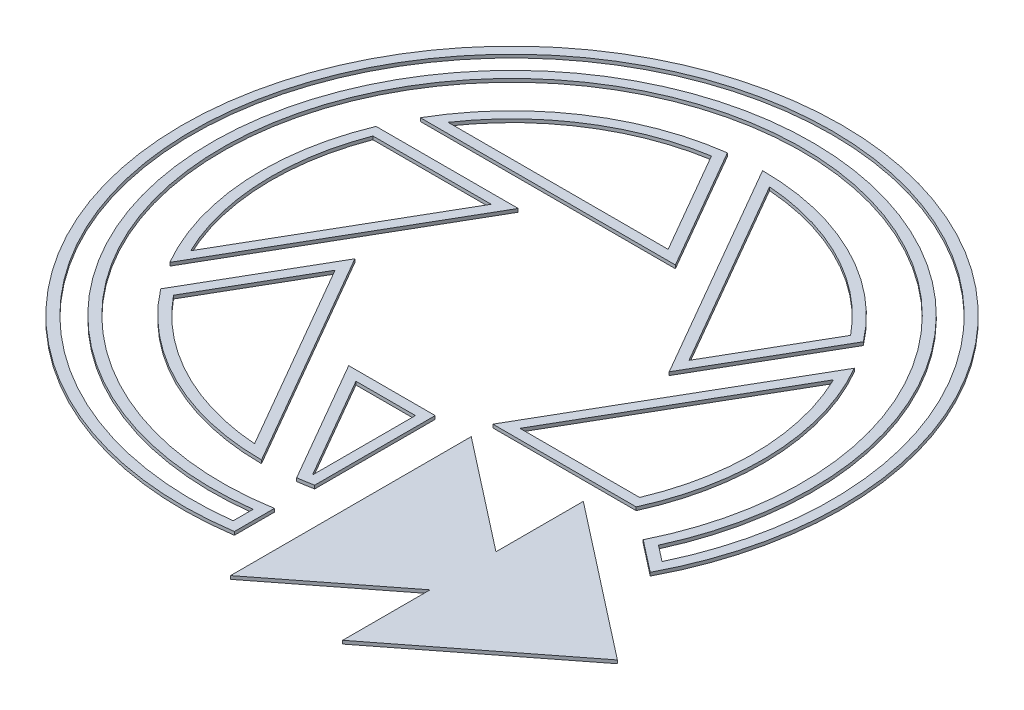
from build123d import *

# Parameters (mm, degrees)
EXTRUDE_1_DEPTH     = 5
EXTRUDE_1_2_DEPTH   = 5
EXTRUDE_1_3_DEPTH   = 5
EXTRUDE_1_4_DEPTH   = 5
EXTRUDE_1_5_DEPTH   = 5
EXTRUDE_1_6_DEPTH   = 5
EXTRUDE_1_7_DEPTH   = 5
EXTRUDE_1_8_DEPTH   = 5
CUT_EXTRUDE_1_DEPTH = 770.470221529


with BuildPart() as part:
    # 草图1 → 凸台-拉伸1 (new body)
    with BuildSketch(Plane(origin=(0, 0, 0), x_dir=(1, 0, 0), z_dir=(0, 1, 0))):
        with BuildLine():
            Line((-109.696551146, 190), (-329.089653438, 190))
            ThreePointArc((-329.089653438, 190), (-211.305466091, 315.832233947), (-50.050204348, 376.68949686))
            Line((-50.050204348, 376.68949686), (57.735026919, 190))
            Line((57.735026919, 190), (-109.696551146, 190))
        make_face()
    extrude(amount=EXTRUDE_1_DEPTH)


with BuildPart() as body_2:
    # 草图1 → Extrude 1 2 (new body)
    with BuildSketch(Plane(origin=(0, 0, 0), x_dir=(1, 0, 0), z_dir=(0, 1, 0))):
        with BuildLine():
            Line((128.449935554, -157.518185391), (219.393102292, 0))
            Line((219.393102292, 0), (329.089653438, 190))
            ThreePointArc((329.089653438, 190), (379.560665165, 18.267497356), (345.815010187, -157.518185391))
            Line((345.815010187, -157.518185391), (128.449935554, -157.518185391))
        make_face()
    extrude(amount=EXTRUDE_1_2_DEPTH)


with BuildPart() as body_3:
    # 草图1 → Extrude 1 3 (new body)
    with BuildSketch(Plane(origin=(0, 0, 0), x_dir=(1, 0, 0), z_dir=(0, 1, 0))):
        with BuildLine():
            Line((193.412340179, 45), (109.696551146, 190))
            Line((109.696551146, 190), (0, 380))
            ThreePointArc((0, 380), (167.866004887, 340.912018567), (301.197571446, 231.68949686))
            Line((301.197571446, 231.68949686), (193.412340179, 45))
        make_face()
    extrude(amount=EXTRUDE_1_3_DEPTH)


with BuildPart() as body_4:
    # 草图1 → Extrude 1 4 (new body)
    with BuildSketch(Plane(origin=(0, 0, 0), x_dir=(1, 0, 0), z_dir=(0, 1, 0))):
        with BuildLine():
            Line((-135.67731326, 145), (-219.393102292, 0))
            Line((-219.393102292, 0), (-329.089653438, -190))
            ThreePointArc((-329.089653438, -190), (-379.171470978, -25.07978462), (-351.247775794, 145))
            Line((-351.247775794, 145), (-135.67731326, 145))
        make_face()
    extrude(amount=EXTRUDE_1_4_DEPTH)


with BuildPart() as body_5:
    # 草图1 → Extrude 1 5 (new body)
    with BuildSketch(Plane(origin=(0, 0, 0), x_dir=(1, 0, 0), z_dir=(0, 1, 0))):
        with BuildLine():
            Line((-193.412340179, -45), (-109.696551146, -190))
            Line((-109.696551146, -190), (0, -380))
            ThreePointArc((0, -380), (-167.866004887, -340.912018567), (-301.197571446, -231.68949686))
            Line((-301.197571446, -231.68949686), (-193.412340179, -45))
        make_face()
    extrude(amount=EXTRUDE_1_5_DEPTH)


with BuildPart() as body_6:
    # 草图1 → Extrude 1 6 (new body)
    with BuildSketch(Plane(origin=(0, 0, 0), x_dir=(1, 0, 0), z_dir=(0, 1, 0))):
        with BuildLine():
            Line((-57.735026919, -190), (73.449935554, -190))
            Line((73.449935554, -190), (73.449935554, -372.83388656))
            ThreePointArc((73.449935554, -372.83388656), (61.780155161, -374.944279098), (50.050204348, -376.68949686))
            Line((50.050204348, -376.68949686), (-57.735026919, -190))
        make_face()
    extrude(amount=EXTRUDE_1_6_DEPTH)


with BuildPart() as body_7:
    # 草图1 → Extrude 1 7 (new body)
    with BuildSketch(Plane(origin=(0, 0, 0), x_dir=(1, 0, 0), z_dir=(0, 1, 0))):
        Polygon((128.449935554, -190.33388656), (128.449935554, -555.33388656), (298.449935554, -422.83388656), (298.449935554, -555.33388656), (532.60087895, -372.83388656), (298.449935554, -190.33388656), (298.449935554, -322.83388656), align=None)
    extrude(amount=EXTRUDE_1_7_DEPTH)


with BuildPart() as body_8:
    # 草图1 → Extrude 1 8 (new body)
    with BuildSketch(Plane(origin=(0, 0, 0), x_dir=(1, 0, 0), z_dir=(0, 1, 0))):
        with BuildLine():
            Line((73.449935554, -433.82612527), (73.449935554, -494.57568376))
            ThreePointArc((73.449935554, -494.57568376), (-289.254482056, 407.838012709), (442.470113798, -232.852310264))
            Line((442.470113798, -232.852310264), (394.283817369, -195.29534393))
            ThreePointArc((394.283817369, -195.29534393), (-262.522283469, 353.103456061), (73.449935554, -433.82612527))
        make_face()
    extrude(amount=EXTRUDE_1_8_DEPTH)


with BuildPart() as cut_extrude_1_tool:
    # 草图2 → 切除-拉伸1 (new, through all)
    with BuildSketch(Plane(origin=(0, 5, 0), x_dir=(1, 0, 0), z_dir=(0, 1, 0))):
        with BuildLine():
            Line((-161.658075373, 130), (-341.064510027, 130))
            ThreePointArc((-341.064510027, 130), (-364.657361136, -15.811671935), (-328.531896481, -159.033936612))
            Line((-328.531896481, -159.033936612), (-232.383483349, 7.5))
            Line((-232.383483349, 7.5), (-161.658075373, 130))
        make_face()
        with BuildLine():
            Line((58.449935554, -205), (-31.754264805, -205))
            Line((-31.754264805, -205), (57.948952522, -360.370530013))
            ThreePointArc((57.948952522, -360.370530013), (58.199458101, -360.330158434), (58.449935554, -360.28961272))
            Line((58.449935554, -360.28961272), (58.449935554, -205))
        make_face()
        with BuildLine():
            Line((-193.412340179, -75), (-283.115557506, -230.370530013))
            ThreePointArc((-283.115557506, -230.370530013), (-168.635370996, -323.708374388), (-26.53851907, -364.033936612))
            Line((-26.53851907, -364.033936612), (-122.686932203, -197.5))
            Line((-122.686932203, -197.5), (-193.412340179, -75))
        make_face()
        with BuildLine():
            Line((31.754264805, 205), (-57.948952522, 360.370530013))
            ThreePointArc((-57.948952522, 360.370530013), (-196.02199014, 307.896702453), (-301.993377411, 205))
            Line((-301.993377411, 205), (-109.696551146, 205))
            Line((-109.696551146, 205), (31.754264805, 205))
        make_face()
        with BuildLine():
            Line((122.686932203, 197.5), (193.412340179, 75))
            Line((193.412340179, 75), (283.115557506, 230.370530013))
            ThreePointArc((283.115557506, 230.370530013), (168.635370996, 323.708374388), (26.53851907, 364.033936612))
            Line((26.53851907, 364.033936612), (122.686932203, 197.5))
        make_face()
        with BuildLine():
            Line((328.531896481, 159.033936612), (232.383483349, -7.5))
            Line((232.383483349, -7.5), (154.430697668, -142.518185391))
            Line((154.430697668, -142.518185391), (336.026140103, -142.518185391))
            ThreePointArc((336.026140103, -142.518185391), (364.887334075, 9.068265075), (328.531896481, 159.033936612))
        make_face()
        with BuildLine():
            Line((58.449935554, -481.465061073), (58.449935554, -451.230102092))
            ThreePointArc((58.449935554, -451.230102092), (-269.289684738, 366.753412654), (413.023640021, -190.883401017))
            Line((413.023640021, -190.883401017), (437.279781879, -209.788923348))
            ThreePointArc((437.279781879, -209.788923348), (-282.646367638, 394.126922274), (58.449935554, -481.465061073))
        make_face()
    extrude(amount=-CUT_EXTRUDE_1_DEPTH)


with BuildPart() as part_1:
    add(part.part)

    # 切除-拉伸1: cut by cut_extrude_1_tool
    add(cut_extrude_1_tool.part, mode=Mode.SUBTRACT)


with BuildPart() as body_2_1:
    add(body_2.part)

    # 切除-拉伸1: cut by cut_extrude_1_tool
    add(cut_extrude_1_tool.part, mode=Mode.SUBTRACT)


with BuildPart() as body_3_1:
    add(body_3.part)

    # 切除-拉伸1: cut by cut_extrude_1_tool
    add(cut_extrude_1_tool.part, mode=Mode.SUBTRACT)


with BuildPart() as body_4_1:
    add(body_4.part)

    # 切除-拉伸1: cut by cut_extrude_1_tool
    add(cut_extrude_1_tool.part, mode=Mode.SUBTRACT)


with BuildPart() as body_5_1:
    add(body_5.part)

    # 切除-拉伸1: cut by cut_extrude_1_tool
    add(cut_extrude_1_tool.part, mode=Mode.SUBTRACT)


with BuildPart() as body_6_1:
    add(body_6.part)

    # 切除-拉伸1: cut by cut_extrude_1_tool
    add(cut_extrude_1_tool.part, mode=Mode.SUBTRACT)


with BuildPart() as body_8_1:
    add(body_8.part)

    # 切除-拉伸1: cut by cut_extrude_1_tool
    add(cut_extrude_1_tool.part, mode=Mode.SUBTRACT)


solid = Compound([body_7.part, part_1.part, body_2_1.part, body_3_1.part, body_4_1.part, body_5_1.part, body_6_1.part, body_8_1.part])
